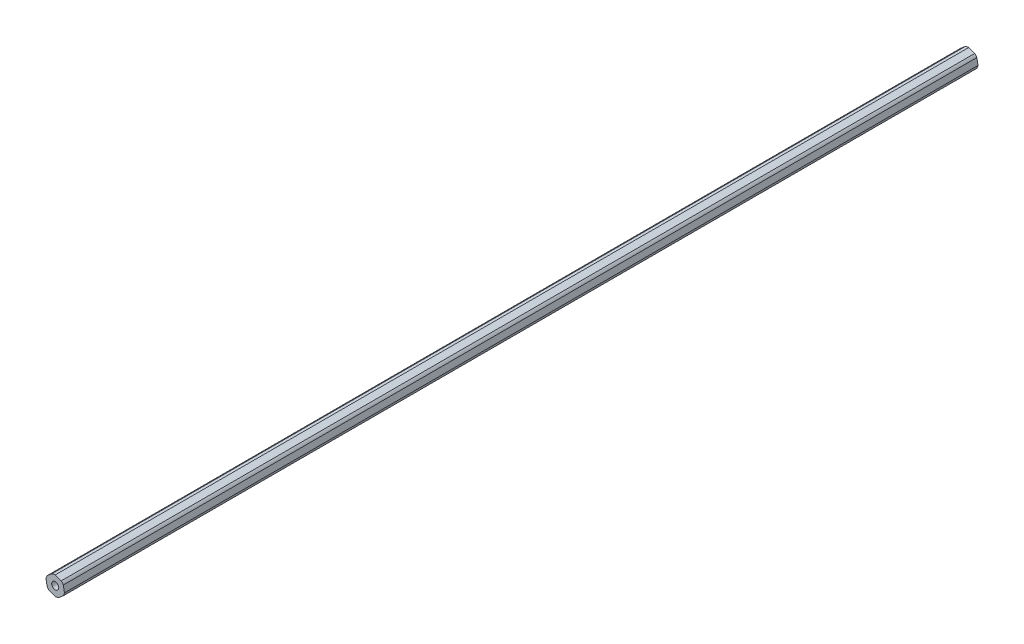
from build123d import *

# Parameters (mm, degrees)
BOSS_EXTRUDE1_DEPTH         = 659.0157
SKETCH2_R                   = 2.0193
CUT_EXTRUDE1_DEPTH          = 660.083862843
F_1_4_20_TAPPED_HOLE1_D     = 5.1054
F_1_4_20_TAPPED_HOLE1_DEPTH = 19.05
F_1_4_20_TAPPED_HOLE1_TIP   = 1.533816902
F_1_4_20_TAPPED_HOLE2_D     = 5.1054
F_1_4_20_TAPPED_HOLE2_DEPTH = 19.05
F_1_4_20_TAPPED_HOLE2_TIP   = 1.533816902


with BuildPart() as part:
    # Sketch1 → Boss-Extrude1 (new body)
    with BuildSketch(Plane.XY):
        with BuildLine():
            Line((-6.654540832, 1.131188008), (-5.845671476, -3.375))
            ThreePointArc((-5.845671476, -3.375), (-5.15742276, -4.354709), (-4.306907968, -5.197407407))
            Line((-4.306907968, -5.197407407), (0, -6.75))
            ThreePointArc((0, -6.75), (1.19257724, -6.643813628), (2.347632865, -6.328595415))
            Line((2.347632865, -6.328595415), (5.845671476, -3.375))
            ThreePointArc((5.845671476, -3.375), (6.35, -2.289104628), (6.654540832, -1.131188008))
            Line((6.654540832, -1.131188008), (5.845671476, 3.375))
            ThreePointArc((5.845671476, 3.375), (5.15742276, 4.354709), (4.306907968, 5.197407407))
            Line((4.306907968, 5.197407407), (0, 6.75))
            ThreePointArc((0, 6.75), (-1.19257724, 6.643813628), (-2.347632865, 6.328595415))
            Line((-2.347632865, 6.328595415), (-5.845671476, 3.375))
            ThreePointArc((-5.845671476, 3.375), (-6.35, 2.289104628), (-6.654540832, 1.131188008))
        make_face()
    extrude(amount=BOSS_EXTRUDE1_DEPTH)

    # Sketch2 → Cut-Extrude1 (cut, through all)
    with BuildSketch(Plane.XY.offset(659.0157)):
        Circle(SKETCH2_R)
    extrude(amount=-CUT_EXTRUDE1_DEPTH, mode=Mode.SUBTRACT)

    # 1/4-20 Tapped Hole1
    with Locations(Plane.XY.offset(659.0157)):
        with Locations((0, 0)):
            Hole(F_1_4_20_TAPPED_HOLE1_D / 2, depth=F_1_4_20_TAPPED_HOLE1_DEPTH)
            with Locations((0, 0, -(F_1_4_20_TAPPED_HOLE1_DEPTH + F_1_4_20_TAPPED_HOLE1_TIP / 2))):  # 118° drill point
                Cone(0, F_1_4_20_TAPPED_HOLE1_D / 2, F_1_4_20_TAPPED_HOLE1_TIP, mode=Mode.SUBTRACT)

    # 1/4-20 Tapped Hole2
    with Locations(Plane(origin=(0, 0, 0), x_dir=(-1, 0, 0), z_dir=(0, 0, -1))):
        with Locations((0, 0)):
            Hole(F_1_4_20_TAPPED_HOLE2_D / 2, depth=F_1_4_20_TAPPED_HOLE2_DEPTH)
            with Locations((0, 0, -(F_1_4_20_TAPPED_HOLE2_DEPTH + F_1_4_20_TAPPED_HOLE2_TIP / 2))):  # 118° drill point
                Cone(0, F_1_4_20_TAPPED_HOLE2_D / 2, F_1_4_20_TAPPED_HOLE2_TIP, mode=Mode.SUBTRACT)


solid = part.part
